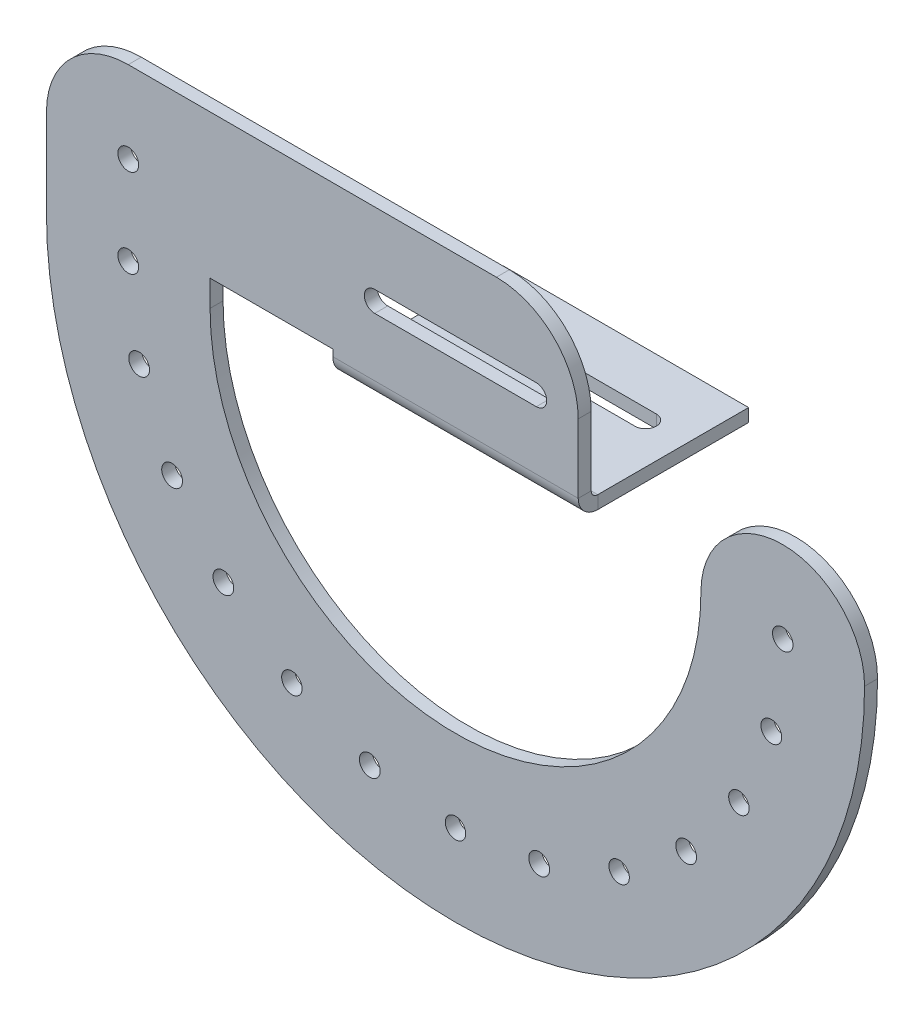
from build123d import *

# Parameters (mm, degrees)
CROQUIS1_R                = 6.35
CROQUIS1_R_2              = 6.26
CROQUIS1_R_3              = 6.25
SALIENTE_EXTRUIR1_DEPTH   = 7.9375
CROQUIS2_W                = 150
CROQUIS2_H                = 104.1375
SALIENTE_EXTRUIR2_DEPTH   = 7.9375
CONVERTIR_S_LIDO1_START   = -75
CONVERTIR_S_LIDO1_DEPTH   = 150
CONVERTIR_S_LIDO1_2_DEPTH = 150


# Read off the part's stored shape, not the designer's step: Convertir-Sólido1
with BuildPart() as part:
    # Croquis1 → Saliente-Extruir1 (new body)
    with BuildSketch(Plane.XY):
        with BuildLine():
            Line((-75, 16), (-75, 0))
            Line((-75, 0), (75, 0))
            Line((75, 0), (75, 54))
            ThreePointArc((75, 54), (60.355339059, 89.355339059), (25, 104))
            Line((25, 104), (-200, 104))
            ThreePointArc((-200, 104), (-235.355339059, 89.355339059), (-250, 54))
            Line((-250, 54), (-250, 0))
            ThreePointArc((-250, 0), (0, -250), (250, 0))
            ThreePointArc((250, 0), (200, 50), (150, 0))
            ThreePointArc((150, 0), (0, -150), (-150, 0))
            Line((-150, 0), (-150, 16))
            Line((-150, 16), (-75, 16))
        make_face()
        with BuildLine():
            ThreePointArc((-49.374105038, 47.65), (-55.724105038, 54), (-49.374105038, 60.35))
            Line((-49.374105038, 60.35), (49.374105038, 60.35))
            ThreePointArc((49.374105038, 60.35), (55.724105038, 54), (49.374105038, 47.65))
            Line((49.374105038, 47.65), (-49.374105038, 47.65))
        make_face(mode=Mode.SUBTRACT)
        with Locations((193.014182094, -52.397762459)):
            Circle(CROQUIS1_R, mode=Mode.SUBTRACT)
        with Locations((200, 0)):
            Circle(CROQUIS1_R_2, mode=Mode.SUBTRACT)
        with Locations((-100, -173.205080757)):
            Circle(CROQUIS1_R_3, mode=Mode.SUBTRACT)
        with Locations((-52.397762459, -193.014182094)):
            Circle(CROQUIS1_R, mode=Mode.SUBTRACT)
        with Locations((-141.884884438, -140.956303754)):
            Circle(CROQUIS1_R, mode=Mode.SUBTRACT)
        with Locations((-173.205080757, -100)):
            Circle(CROQUIS1_R, mode=Mode.SUBTRACT)
        with Locations((0, -200)):
            Circle(CROQUIS1_R_3, mode=Mode.SUBTRACT)
        with Locations((51.129297656, -193.354066213)):
            Circle(CROQUIS1_R, mode=Mode.SUBTRACT)
        with Locations((100, -173.205080757)):
            Circle(CROQUIS1_R_3, mode=Mode.SUBTRACT)
        with Locations((140.956303754, -141.884884438)):
            Circle(CROQUIS1_R, mode=Mode.SUBTRACT)
        with Locations((173.205080757, -100)):
            Circle(CROQUIS1_R_3, mode=Mode.SUBTRACT)
        with Locations((-193.354066213, -51.129297656)):
            Circle(CROQUIS1_R, mode=Mode.SUBTRACT)
        with Locations((-200, 0)):
            Circle(CROQUIS1_R, mode=Mode.SUBTRACT)
        with Locations((-200, 54)):
            Circle(CROQUIS1_R, mode=Mode.SUBTRACT)
    extrude(amount=SALIENTE_EXTRUIR1_DEPTH)

    # Croquis2 → Saliente-Extruir2 (add)
    with BuildSketch(Plane.XZ):
        with Locations((0, -44.13125)):
            Rectangle(CROQUIS2_W, CROQUIS2_H)
        with BuildLine():
            Line((-50.16849794, -51.6), (50.16849794, -51.6))
            ThreePointArc((50.16849794, -51.6), (56.66849794, -58.1), (50.16849794, -64.6))
            Line((50.16849794, -64.6), (-50.16849794, -64.6))
            ThreePointArc((-50.16849794, -64.6), (-56.66849794, -58.1), (-50.16849794, -51.6))
        make_face(mode=Mode.SUBTRACT)
    extrude(amount=-SALIENTE_EXTRUIR2_DEPTH)

    # Convertir-Sólido1 outline → Convertir-Sólido1 (cut)
    with BuildSketch(Plane.YZ.offset(CONVERTIR_S_LIDO1_START)):
        with BuildLine():
            ThreePointArc((0, -4), (3.4964128, 4.4410872), (11.9375, 7.9375))
            Line((11.9375, 7.9375), (0, 7.9375))
            Line((0, 7.9375), (0, -4))
        make_face()
    extrude(amount=CONVERTIR_S_LIDO1_DEPTH, mode=Mode.SUBTRACT)

    # Convertir-S_lido1 2 outline → Convertir-S_lido1 2 (add)
    with BuildSketch(Plane.YZ.offset(CONVERTIR_S_LIDO1_START)):
        with BuildLine():
            Line((11.9375, 0), (7.9375, 0))
            Line((7.9375, 0), (7.9375, -4))
            ThreePointArc((7.9375, -4), (9.109072875, -1.171572875), (11.9375, 0))
        make_face()
    extrude(amount=CONVERTIR_S_LIDO1_2_DEPTH)


solid = part.part
